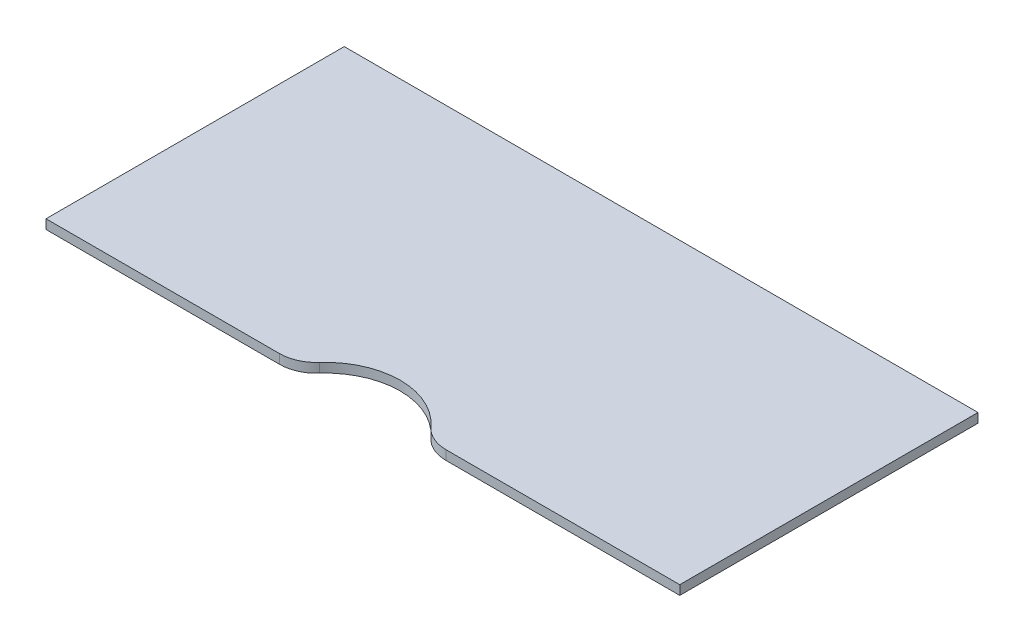
from build123d import *

# Parameters (mm, degrees)
BOSS_EXTRUDE1_DEPTH = 3.175
FILLET1_R           = 12.7


with BuildPart() as part:
    # Sketch1 → Boss-Extrude1 (new body)
    with BuildSketch(Plane(origin=(0, 0, 0), x_dir=(1, 0, 0), z_dir=(0, 1, 0))):
        with BuildLine():
            Line((0, 228.6), (0, 127))
            Line((0, 127), (85.952954744, 127))
            ThreePointArc((85.952954744, 127), (107.95, 139.7), (129.947045256, 127))
            Line((129.947045256, 127), (215.9, 127))
            Line((215.9, 127), (215.9, 228.6))
            Line((215.9, 228.6), (0, 228.6))
        make_face()
    extrude(amount=BOSS_EXTRUDE1_DEPTH)

    # Fillet1
    fillet1_edges = [part.edges().sort_by_distance(p)[0] for p in [
        (129.947045256, 1.5875, -127),
        (85.952954744, 1.5875, -127),
    ]]
    fillet(fillet1_edges, radius=FILLET1_R)


solid = part.part
